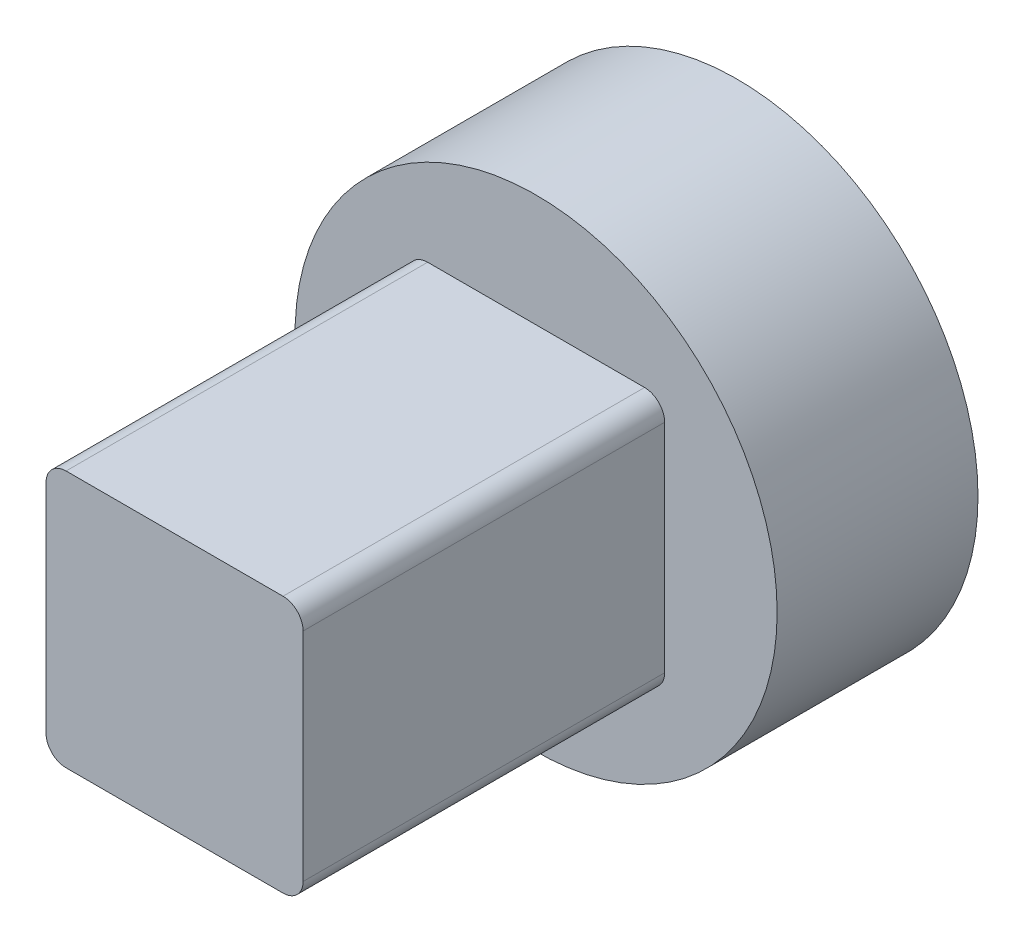
from build123d import *

# Parameters (mm, degrees)
SKETCH1_R           = 6
SKETCH1_R_2         = 2.4
BOSS_EXTRUDE1_DEPTH = 5
BOSS_EXTRUDE2_DEPTH = 9


with BuildPart() as part:
    # Sketch1 → Boss-Extrude1 (new body)
    with BuildSketch(Plane.XY.offset(-23.465471353)):
        with Locations((3.740457308, -31.828386779)):
            Circle(SKETCH1_R)
        with Locations((3.740457308, -31.828386779)):
            Circle(SKETCH1_R_2, mode=Mode.SUBTRACT)
    extrude(amount=BOSS_EXTRUDE1_DEPTH)

    # Sketch2 → Boss-Extrude2 (add)
    with BuildSketch(Plane.XY.offset(-18.465471353)):
        with BuildLine():
            Line((6.440457308, -28.628386779), (1.040457308, -28.628386779))
            ThreePointArc((1.040457308, -28.628386779), (0.686903918, -28.774833388), (0.540457308, -29.128386779))
            Line((0.540457308, -29.128386779), (0.540457308, -34.528386779))
            ThreePointArc((0.540457308, -34.528386779), (0.686903918, -34.881940169), (1.040457308, -35.028386779))
            Line((1.040457308, -35.028386779), (6.440457308, -35.028386779))
            ThreePointArc((6.440457308, -35.028386779), (6.794010699, -34.881940169), (6.940457308, -34.528386779))
            Line((6.940457308, -34.528386779), (6.940457308, -29.128386779))
            ThreePointArc((6.940457308, -29.128386779), (6.794010699, -28.774833388), (6.440457308, -28.628386779))
        make_face()
    extrude(amount=BOSS_EXTRUDE2_DEPTH)


solid = part.part
